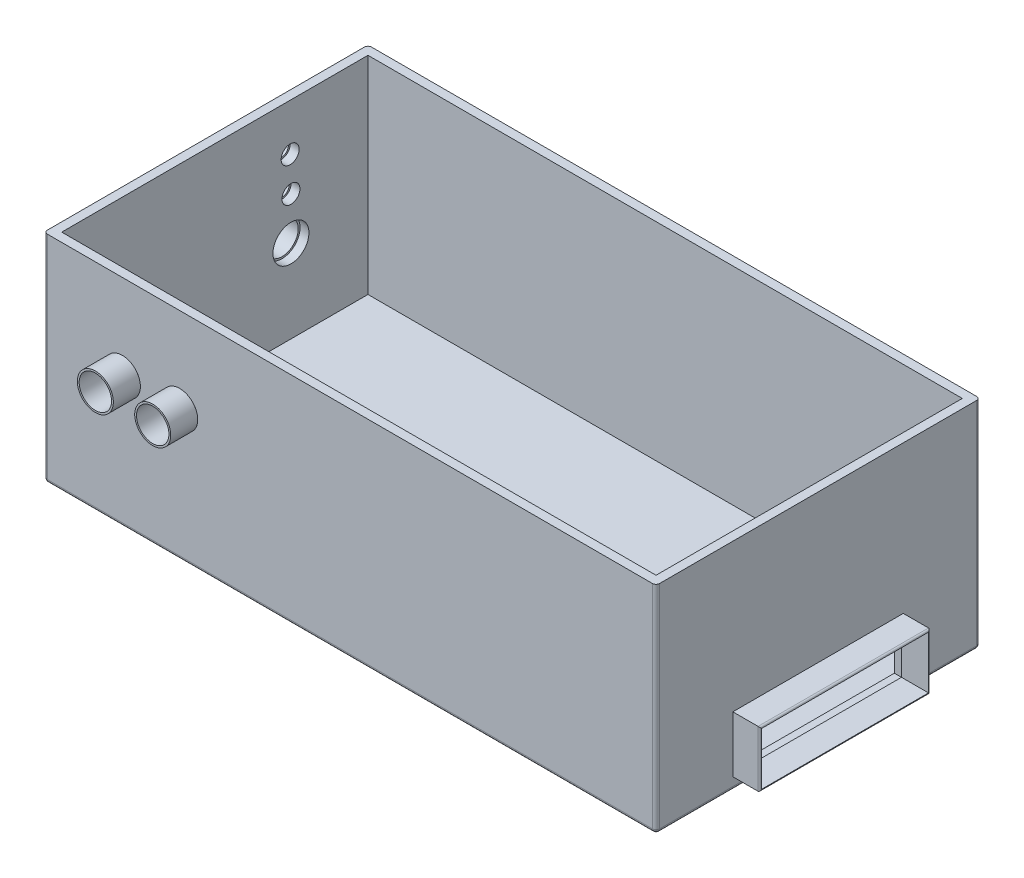
from build123d import *

# Parameters (mm, degrees)
SKETCH1_W             = 170
SKETCH1_H             = 90
BOSS_EXTRUDE2_DEPTH   = 60
SHELL2_T              = -2.473839036
SKETCH4_W             = 47.329999632
SKETCH4_H             = 15.617306276
CUT_EXTRUDE3_DEPTH    = 95
SKETCH5_R             = 5
CUT_EXTRUDE4_DEPTH    = 82.49790304
SKETCH11_R            = 2.5
CUT_EXTRUDE5_DEPTH    = 10
SKETCH12_R            = 2.5
CUT_EXTRUDE6_DEPTH    = 10
SKETCH13_R            = 5
CUT_EXTRUDE7_DEPTH    = 10
SKETCH18_R            = 2.5
BOSS_EXTRUDE4_DEPTH   = 7.5
SHELL5_T              = -0.5
SKETCH19_R            = 2.5
BOSS_EXTRUDE5_DEPTH   = 7.5
SHELL6_T              = -0.5
SKETCH20_R            = 5
BOSS_EXTRUDE6_DEPTH   = 7.5
SHELL7_T              = -0.5
SKETCH21_R            = 5
BOSS_EXTRUDE7_DEPTH   = 7.5
BOSS_EXTRUDE7_2_DEPTH = 7.5
SHELL8_T              = -0.5
SHELL9_T              = -0.5
SKETCH23_W            = 47.329999632
SKETCH23_H            = 15.617306276
BOSS_EXTRUDE8_DEPTH   = 7.5
SHELL10_T             = -0.5
FILLET1_START         = 2
FILLET1_DEPTH         = 18
FILLET1_START_2       = -25
FILLET1_2_DEPTH       = 50
FILLET3_R             = 1
FILLET4_R             = 1


with BuildPart() as part:
    # Sketch1 → Boss-Extrude2 (new body)
    with BuildSketch(Plane(origin=(0, 0, 0), x_dir=(1, 0, 0), z_dir=(0, 1, 0))):
        Rectangle(SKETCH1_W, SKETCH1_H)
    extrude(amount=BOSS_EXTRUDE2_DEPTH)

    # Shell2
    shell2_openings = [part.faces().sort_by_distance(p)[0] for p in [
        (0, 60, 0),
    ]]
    offset(amount=SHELL2_T, openings=shell2_openings, kind=Kind.INTERSECTION)

    # Sketch4 → Cut-Extrude3 (cut)
    with BuildSketch(Plane(origin=(0, 0, 0), x_dir=(0, 0, -1), z_dir=(1, 0, 0))):
        with Locations((0, 11.155648294)):
            Rectangle(SKETCH4_W, SKETCH4_H)
    extrude(amount=CUT_EXTRUDE3_DEPTH, mode=Mode.SUBTRACT)

    # Sketch5 → Cut-Extrude4 (cut)
    with BuildSketch(Plane.XY):
        with Locations(Location((-63.203440073, 36.260575633, 0), (0, 0, 180))):
            Circle(SKETCH5_R)
        with Locations(Location((-47.276275906, 36.260575633, 0), (0, 0, 180))):
            Circle(SKETCH5_R)
    extrude(amount=CUT_EXTRUDE4_DEPTH, mode=Mode.SUBTRACT)

    # Sketch11 → Cut-Extrude5 (cut)
    with BuildSketch(Plane.ZY.offset(85)):
        with Locations((-20.923207268, 46.987362625)):
            Circle(SKETCH11_R)
    extrude(amount=-CUT_EXTRUDE5_DEPTH, mode=Mode.SUBTRACT)

    # Sketch12 → Cut-Extrude6 (cut)
    with BuildSketch(Plane.ZY.offset(85)):
        with Locations((-21.137371962, 37.352812096)):
            Circle(SKETCH12_R)
    extrude(amount=-CUT_EXTRUDE6_DEPTH, mode=Mode.SUBTRACT)

    # Sketch13 → Cut-Extrude7 (cut)
    with BuildSketch(Plane.ZY.offset(85)):
        with Locations((-21.137371962, 25.536121377)):
            Circle(SKETCH13_R)
    extrude(amount=-CUT_EXTRUDE7_DEPTH, mode=Mode.SUBTRACT)

    # Fillet3
    fillet3_edges = [part.edges().sort_by_distance(p)[0] for p in [
        (85, 30, 45),
        (-85, 30, 45),
        (-85, 30, -45),
        (85, 30, -45),
    ]]
    fillet(fillet3_edges, radius=FILLET3_R)

    # Fillet4
    fillet4_edges = [part.edges().sort_by_distance(p)[0] for p in [
        (-85, 0, 0),
        (85, 0, 0),
        (0, 0, 45),
        (0, 0, -45),
        (84.707106781, 0, 44.707106781),
        (-84.707106781, 0, 44.707106781),
        (84.707106781, 0, -44.707106781),
        (-84.707106781, 0, -44.707106781),
    ]]
    fillet(fillet4_edges, radius=FILLET4_R)


with BuildPart() as body_2:
    # Sketch18 → Boss-Extrude4 (new body)
    with BuildSketch(Plane.ZY.offset(85)):
        with Locations((-20.923207268, 46.987362625)):
            Circle(SKETCH18_R)
    extrude(amount=BOSS_EXTRUDE4_DEPTH)

    # Shell5
    shell5_openings = [body_2.faces().sort_by_distance(p)[0] for p in [
        (-92.5, 46.987362625, -20.923207268),
        (-85, 46.987362625, -20.923207268),
    ]]
    offset(amount=SHELL5_T, openings=shell5_openings, kind=Kind.INTERSECTION)


with BuildPart() as body_3:
    # Sketch19 → Boss-Extrude5 (new body)
    with BuildSketch(Plane.ZY.offset(85)):
        with Locations((-21.137371962, 37.352812096)):
            Circle(SKETCH19_R)
    extrude(amount=BOSS_EXTRUDE5_DEPTH)

    # Shell6
    shell6_openings = [body_3.faces().sort_by_distance(p)[0] for p in [
        (-92.5, 37.352812096, -21.137371962),
        (-85, 37.352812096, -21.137371962),
    ]]
    offset(amount=SHELL6_T, openings=shell6_openings, kind=Kind.INTERSECTION)


with BuildPart() as body_4:
    # Sketch20 → Boss-Extrude6 (new body)
    with BuildSketch(Plane.ZY.offset(85)):
        with Locations((-21.137371962, 25.536121377)):
            Circle(SKETCH20_R)
    extrude(amount=BOSS_EXTRUDE6_DEPTH)

    # Shell7
    shell7_openings = [body_4.faces().sort_by_distance(p)[0] for p in [
        (-92.5, 25.536121377, -21.137371962),
        (-85, 25.536121377, -21.137371962),
    ]]
    offset(amount=SHELL7_T, openings=shell7_openings, kind=Kind.INTERSECTION)


with BuildPart() as body_5:
    # Sketch21 → Boss-Extrude7 (new body)
    with BuildSketch(Plane.XY.offset(45)):
        with Locations((-63.203440073, 36.260575633)):
            Circle(SKETCH21_R)
    extrude(amount=BOSS_EXTRUDE7_DEPTH)

    # Shell8
    shell8_openings = [body_5.faces().sort_by_distance(p)[0] for p in [
        (-63.203440073, 36.260575633, 52.5),
        (-63.203440073, 36.260575633, 45),
    ]]
    offset(amount=SHELL8_T, openings=shell8_openings, kind=Kind.INTERSECTION)


with BuildPart() as body_6:
    # Sketch21 → Boss-Extrude7 2 (new body)
    with BuildSketch(Plane.XY.offset(45)):
        with Locations((-47.276275906, 36.260575633)):
            Circle(SKETCH21_R)
    extrude(amount=BOSS_EXTRUDE7_2_DEPTH)

    # Shell9
    shell9_openings = [body_6.faces().sort_by_distance(p)[0] for p in [
        (-47.276275906, 36.260575633, 52.5),
        (-47.276275906, 36.260575633, 45),
    ]]
    offset(amount=SHELL9_T, openings=shell9_openings, kind=Kind.INTERSECTION)


with BuildPart() as body_7:
    # Sketch23 → Boss-Extrude8 (new body)
    with BuildSketch(Plane(origin=(85, 0, 0), x_dir=(0, 0, -1), z_dir=(1, 0, 0))):
        with Locations((0, 11.155648294)):
            Rectangle(SKETCH23_W, SKETCH23_H)
    extrude(amount=BOSS_EXTRUDE8_DEPTH)

    # Shell10
    shell10_openings = [body_7.faces().sort_by_distance(p)[0] for p in [
        (92.5, 11.155648294, 0),
        (85, 11.155648294, 0),
    ]]
    offset(amount=SHELL10_T, openings=shell10_openings, kind=Kind.INTERSECTION)

    # Fillet1: read off the stored shape, not the designer's step
    # Fillet1 outline → Fillet1 (cut)
    with BuildSketch(Plane(origin=(0, 0, 0), x_dir=(1, 0, 0), z_dir=(0, 1, 0)).offset(FILLET1_START)):
        with BuildLine():
            ThreePointArc((92, 23.664999816), (92.353553391, 23.518553207), (92.5, 23.164999816))
            Line((92.5, 23.164999816), (92.5, 23.664999816))
            Line((92.5, 23.664999816), (92, 23.664999816))
        make_face()
        with BuildLine():
            ThreePointArc((92.5, -23.164999816), (92.353553391, -23.518553207), (92, -23.664999816))
            Line((92, -23.664999816), (92.5, -23.664999816))
            Line((92.5, -23.664999816), (92.5, -23.164999816))
        make_face()
    extrude(amount=FILLET1_DEPTH, mode=Mode.SUBTRACT)

    # Fillet1 2 outline → Fillet1 2 (cut)
    with BuildSketch(Plane.XY.offset(FILLET1_START_2)):
        with BuildLine():
            ThreePointArc((92.5, 3.846995156), (92.35355339, 3.493441765), (92, 3.346995156))
            Line((92, 3.346995156), (92.5, 3.346995156))
            Line((92.5, 3.346995156), (92.5, 3.846995156))
        make_face()
        with BuildLine():
            Line((92.5, 18.964301432), (92, 18.964301432))
            ThreePointArc((92, 18.964301432), (92.353553391, 18.817854823), (92.5, 18.464301432))
            Line((92.5, 18.464301432), (92.5, 18.964301432))
        make_face()
    extrude(amount=FILLET1_2_DEPTH, mode=Mode.SUBTRACT)


solid = Compound([part.part, body_2.part, body_3.part, body_4.part, body_5.part, body_6.part, body_7.part])
